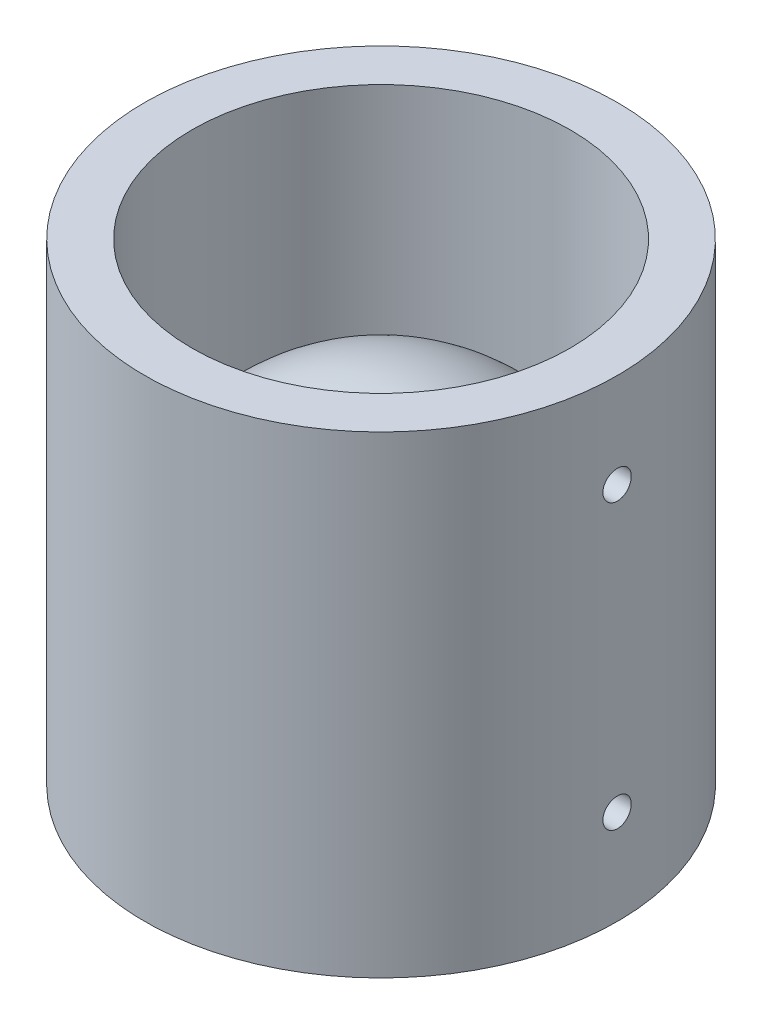
from build123d import *

# Parameters (mm, degrees)
SKETCH1_W          = 0.01
SKETCH1_H          = 4
SKETCH1_W_2        = 2
SKETCH1_H_2        = 20
CUT_EXTRUDE1_REACH = 32
SKETCH2_R          = 0.6
CHAMFER1_SIZE      = 0.5


with BuildPart() as part:
    # Sketch1 → Revolve1 (revolve)
    with BuildSketch(Plane.XY, mode=Mode.PRIVATE) as revolve1_sk:
        with BuildLine():
            Line((0, 14.630942634), (0, 13.230942634))
            ThreePointArc((0, 13.230942634), (5.719297581, 10.578866966), (7.39, 4.5))
            Line((7.39, 4.5), (7.99, 4.5))
            Line((7.99, 4.5), (7.99, 8.5))
            ThreePointArc((7.99, 8.5), (5.035587294, 12.921591081), (0, 14.630942634))
        make_face()
        with Locations((7.995, 6.5)):
            Rectangle(SKETCH1_W, SKETCH1_H)
        with Locations((9, 10)):
            Rectangle(SKETCH1_W_2, SKETCH1_H_2)
    revolve(revolve1_sk.sketch.rotate(Axis((0, 0, 0), (0, 1, 0)), 90), axis=Axis((0, 0, 0), (0, 1, 0)))

    # Sketch2 → Cut-Extrude1 (cut, up to next)
    with BuildSketch(Plane(origin=(10, 0, 0), x_dir=(0, 0, -1), z_dir=(1, 0, 0)), mode=Mode.PRIVATE) as cut_extrude1_sk1:
        with Locations((0, 16)):
            Circle(SKETCH2_R)
    cut_extrude1_tool1 = extrude(cut_extrude1_sk1.sketch, amount=-CUT_EXTRUDE1_REACH, mode=Mode.PRIVATE) & part.part
    # Sketch2 → Cut-Extrude1 (cut, up to next)
    with BuildSketch(Plane(origin=(10, 0, 0), x_dir=(0, 0, -1), z_dir=(1, 0, 0)), mode=Mode.PRIVATE) as cut_extrude1_sk2:
        with Locations((0, 4)):
            Circle(SKETCH2_R)
    cut_extrude1_tool2 = extrude(cut_extrude1_sk2.sketch, amount=-CUT_EXTRUDE1_REACH, mode=Mode.PRIVATE) & part.part
    add(cut_extrude1_tool1.solids().sort_by_distance((10, 16, 0))[0], mode=Mode.SUBTRACT)
    add(cut_extrude1_tool2.solids().sort_by_distance((10, 4, 0))[0], mode=Mode.SUBTRACT)

    # Chamfer1
    # the kernel refuses this chamfer: 1, 0.5 mm, written as the material it takes off along each edge
    with BuildSketch(Plane(origin=(0, 4.5, 0), x_dir=(0, 0, -1), z_dir=(1, 0, 0))) as chamfer1_piece_1:
        with BuildLine():
            Line((7.39 + CHAMFER1_SIZE, 0), (7.492670793, 1.1705165))
            ThreePointArc((7.492670793, 1.1705165), (7.465898714, 0.601555049), (7.39, 0))
            Line((7.39, 0), (7.39 + CHAMFER1_SIZE, 0))
        make_face()
    revolve(axis=Axis((0, 4.5, 0), (0, 1, 0)), revolution_arc=290.997944541, mode=Mode.SUBTRACT)
    with BuildSketch(Plane(origin=(0, 4.5, 0), x_dir=(0.9340589469331272, 0, 0.3571188648813968), z_dir=(-0.3571188648813968, 0, 0.9340589469331272))) as chamfer1_piece_2:
        with BuildLine():
            Line((7.39 + CHAMFER1_SIZE, 0), (7.492670793, 1.1705165))
            ThreePointArc((7.492670793, 1.1705165), (7.465898714, 0.601555049), (7.39, 0))
            Line((7.39, 0), (7.39 + CHAMFER1_SIZE, 0))
        make_face()
    revolve(axis=Axis((0, 4.5, 0), (0, 1, 0)), revolution_arc=110.92336072, mode=Mode.SUBTRACT)


solid = part.part
